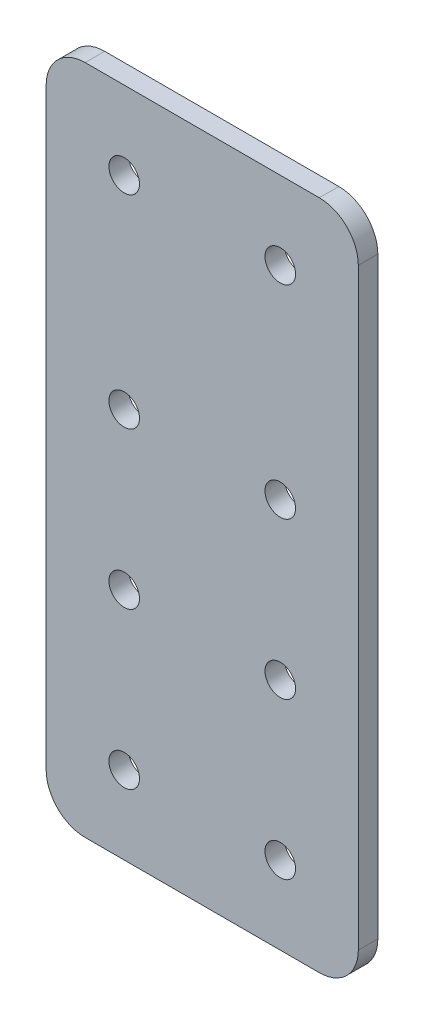
from build123d import *

# Parameters (mm, degrees)
SKETCH2_W           = 50.8
SKETCH2_H           = 109.22
BOSS_EXTRUDE1_DEPTH = 3.175
SKETCH3_R           = 2.4892
CUT_EXTRUDE1_DEPTH  = 121.497838259
FILLET1_R           = 6.35


with BuildPart() as part:
    # Sketch2 → Boss-Extrude1 (new body)
    with BuildSketch(Plane.XY):
        with Locations((25.4, 54.61)):
            Rectangle(SKETCH2_W, SKETCH2_H)
    extrude(amount=-BOSS_EXTRUDE1_DEPTH)

    # Sketch3 → Cut-Extrude1 (cut, through all)
    with BuildSketch(Plane.XY):
        with Locations((12.7, 96.52)):
            Circle(SKETCH3_R)
        with Locations((38.1, 96.52)):
            Circle(SKETCH3_R)
        with Locations((12.7, 63.5)):
            Circle(SKETCH3_R)
        with Locations((12.7, 38.1)):
            Circle(SKETCH3_R)
        with Locations((12.7, 12.7)):
            Circle(SKETCH3_R)
        with Locations((12.7, -12.7)):
            Circle(SKETCH3_R)
        with Locations((12.7, -38.1)):
            Circle(SKETCH3_R)
        with Locations((38.1, 38.1)):
            Circle(SKETCH3_R)
        with Locations((38.1, 12.7)):
            Circle(SKETCH3_R)
        with Locations((38.1, -12.7)):
            Circle(SKETCH3_R)
        with Locations((38.1, -38.1)):
            Circle(SKETCH3_R)
        with Locations((38.1, 63.5)):
            Circle(SKETCH3_R)
    extrude(amount=-CUT_EXTRUDE1_DEPTH, mode=Mode.SUBTRACT)

    # Fillet1
    fillet1_edges = [part.edges().sort_by_distance(p)[0] for p in [
        (0, 0, -1.5875),
        (50.8, 0, -1.5875),
        (50.8, 109.22, -1.5875),
        (0, 109.22, -1.5875),
    ]]
    fillet(fillet1_edges, radius=FILLET1_R)


solid = part.part
